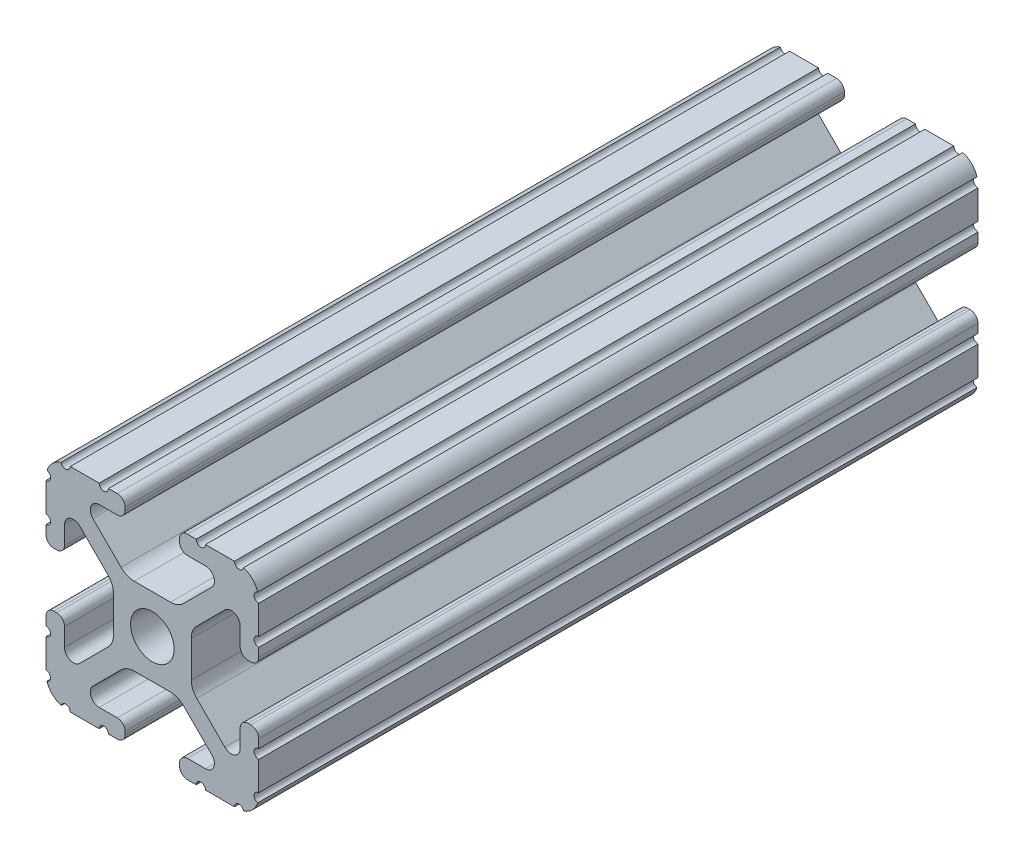
from build123d import *

# Parameters (mm, degrees)
BOSS_EXTRUDE1_DEPTH     = 42.95
CUT_EXTRUDE1_DEPTH      = 47.554081454
CUT_EXTRUDE1_DEPTH_BACK = 47.554081454
SKETCH5_R               = 0.55245
CUT_EXTRUDE2_DEPTH      = 47.554081454
CUT_EXTRUDE2_DEPTH_BACK = 47.554081454
SKETCH6_R               = 2.555


with BuildPart() as part:
    # Sketch4 → Boss-Extrude1 (new, symmetric)
    with BuildSketch(Plane.XY):
        with BuildLine():
            Line((4.190365, -12.7), (10.11729625, -12.7))
            ThreePointArc((10.11729625, -12.7), (11.943543585, -11.943543585), (12.7, -10.11729625))
            Line((12.7, -10.11729625), (12.7, -4.190365))
            ThreePointArc((12.7, -4.190365), (12.42492494, -3.52627506), (11.760835, -3.2512))
            Line((11.760835, -3.2512), (11.429365, -3.2512))
            ThreePointArc((11.429365, -3.2512), (10.76527506, -3.52627506), (10.4902, -4.190365))
            Line((10.4902, -4.190365), (10.4902, -6.348478019))
            ThreePointArc((10.4902, -6.348478019), (9.830707141, -7.335478831), (8.666460301, -7.103895736))
            Line((8.666460301, -7.103895736), (5.299899128, -3.737334563))
            ThreePointArc((5.299899128, -3.737334563), (4.817571085, -3.015479634), (4.6482, -2.16399369))
            Line((4.6482, -2.16399369), (4.6482, 0))
            Line((4.6482, 0), (2.6035, 0))
            ThreePointArc((2.6035, 0), (1.840952505, -1.840952505), (0, -2.6035))
            Line((0, -2.6035), (0, -4.6482))
            Line((0, -4.6482), (2.16399369, -4.6482))
            ThreePointArc((2.16399369, -4.6482), (3.015479634, -4.817571085), (3.737334563, -5.299899128))
            Line((3.737334563, -5.299899128), (7.103895736, -8.666460301))
            ThreePointArc((7.103895736, -8.666460301), (7.335478831, -9.830707141), (6.348478019, -10.4902))
            Line((6.348478019, -10.4902), (4.190365, -10.4902))
            ThreePointArc((4.190365, -10.4902), (3.52627506, -10.76527506), (3.2512, -11.429365))
            Line((3.2512, -11.429365), (3.2512, -11.760835))
            ThreePointArc((3.2512, -11.760835), (3.52627506, -12.42492494), (4.190365, -12.7))
        make_face()
    extrude(amount=BOSS_EXTRUDE1_DEPTH, both=True)

    # Sketch5 → Cut-Extrude1 (cut, two sides: drawn at the far end of the back side and taken through both)
    with BuildSketch(Plane.XY.offset(-CUT_EXTRUDE1_DEPTH_BACK)):
        with Locations((10.356153152, -12.7)):
            Circle(SKETCH5_R)
        with Locations((5.796028019, -12.7)):
            Circle(SKETCH5_R)
        with Locations((12.7, -10.356153152)):
            Circle(SKETCH5_R)
        with Locations((12.7, -5.796028019)):
            Circle(SKETCH5_R)
    extrude(amount=CUT_EXTRUDE1_DEPTH + CUT_EXTRUDE1_DEPTH_BACK, mode=Mode.SUBTRACT)

    # Mirror1: part across plane


with BuildPart() as part_1:
    add(part.part)
    add(part.part.mirror(Plane(origin=(0, 0, 0), x_dir=(0, 0, 1), z_dir=(1, 0, 0))))

    # Mirror2: part across plane


with BuildPart() as part_2:
    add(part_1.part)
    add(part_1.part.mirror(Plane.ZX))

    # Sketch6 → Cut-Extrude2 (cut, two sides: drawn at the far end of the back side and taken through both)
    with BuildSketch(Plane(origin=(0, 0, 0), x_dir=(1, 0, 0), z_dir=(0, 1, 0)).offset(-CUT_EXTRUDE2_DEPTH_BACK)):
        with Locations((0, -30.25)):
            Circle(SKETCH6_R)
        with Locations((0, 30.25)):
            Circle(SKETCH6_R)
    extrude(amount=CUT_EXTRUDE2_DEPTH + CUT_EXTRUDE2_DEPTH_BACK, mode=Mode.SUBTRACT)


solid = part_2.part
